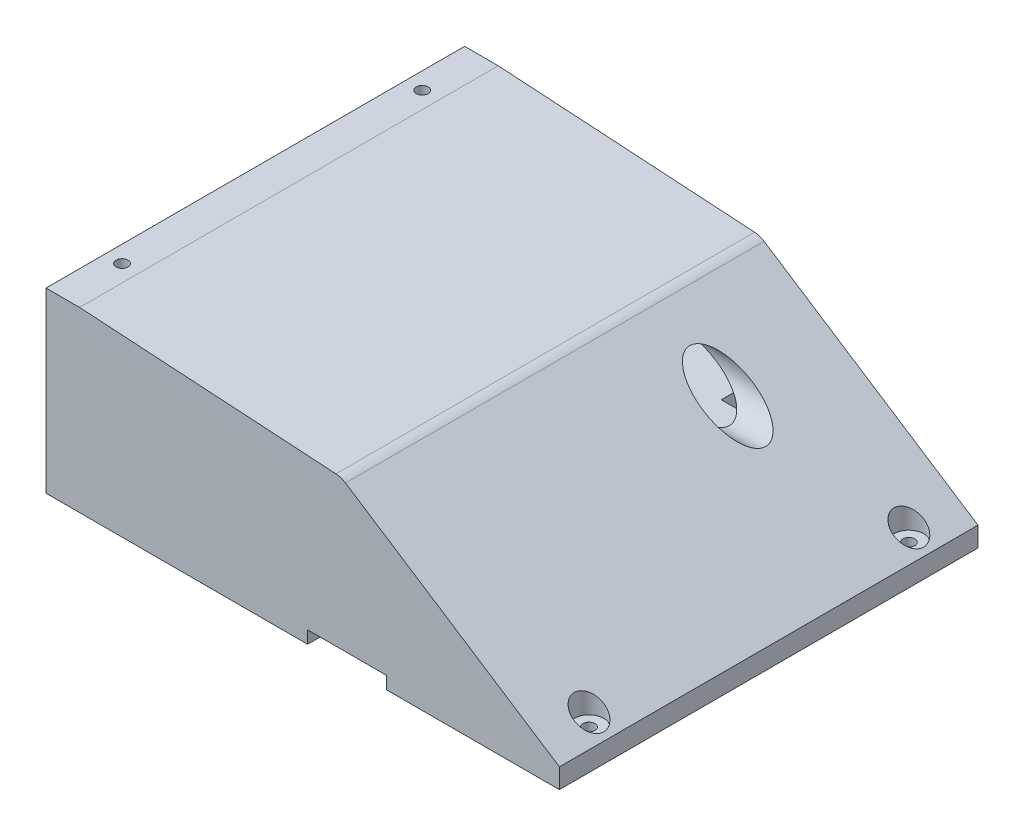
from build123d import *

# Parameters (mm, degrees)
BOSS_EXTRUDE1_DEPTH     = 212
BOSS_EXTRUDE2_DEPTH     = 10
BOSS_EXTRUDE3_DEPTH     = 10
SKETCH4_R               = 3
CUT_EXTRUDE1_DEPTH      = 348.338451658
SKETCH6_R               = 7.5
CUT_EXTRUDE2_DEPTH      = 345.882588717
SKETCH7_R               = 1.5
SKETCH7_R_2             = 12.5
SKETCH7_W               = 10
SKETCH7_H               = 120
SKETCH7_W_2             = 60
SKETCH7_H_2             = 15
CUT_EXTRUDE3_DEPTH      = 12.5
CUT_EXTRUDE4_REACH      = 276.574
SKETCH8_R               = 12.5
CUT_EXTRUDE5_DEPTH      = 342.714793358
CUT_EXTRUDE5_DEPTH_BACK = 342.714793358
SKETCH9_R               = 3
CUT_EXTRUDE6_DEPTH      = 348.338451658
CUT_EXTRUDE6_DEPTH_BACK = 348.338451658
SKETCH10_W              = 40
SKETCH10_H              = 6.35
FILLET1_R               = 10


with BuildPart() as part:
    # Sketch1 → Boss-Extrude1 (new body)
    with BuildSketch(Plane.XY):
        Polygon((0, 0), (-20, 0), (-20, 20), (-242.984559153, 20), (-242.984559153, 25), (-260, 25), (-260, 30), (-49.158083864, 30), (-122.301669645, 77.5), (-242.984559153, 85), (-260, 85), (-260, 90), (-242.984559153, 90), (-110.511971445, 81.767313396), (0, 10), align=None)
    extrude(amount=BOSS_EXTRUDE1_DEPTH)

    # Sketch2 → Boss-Extrude2 (add)
    with BuildSketch(Plane(origin=(0, 0, 0), x_dir=(-1, 0, 0), z_dir=(0, 0, -1))):
        Polygon((0, 0), (260, 0), (260, 90), (110.511971445, 81.767313396), (0, 10), align=None)
    extrude(amount=-BOSS_EXTRUDE2_DEPTH)

    # Sketch3 → Boss-Extrude3 (add)
    with BuildSketch(Plane.XY.offset(212)):
        Polygon((-110.511971445, 81.767313396), (0, 10), (0, 0), (-260, 0), (-260, 90), align=None)
    extrude(amount=-BOSS_EXTRUDE3_DEPTH)

    # Sketch4 → Cut-Extrude1 (cut, through all)
    with BuildSketch(Plane.XZ):
        with Locations((-10, 187)):
            Circle(SKETCH4_R)
        with Locations((-10, 25)):
            Circle(SKETCH4_R)
    extrude(amount=-CUT_EXTRUDE1_DEPTH, mode=Mode.SUBTRACT)

    # Sketch6 → Cut-Extrude2 (cut, through all)
    with BuildSketch(Plane(origin=(0, 10, 0), x_dir=(-1, 0, 0), z_dir=(0, -1, 0))):
        with Locations((10, -25)):
            Circle(SKETCH6_R)
        with Locations((10, -187)):
            Circle(SKETCH6_R)
    extrude(amount=-CUT_EXTRUDE2_DEPTH, mode=Mode.SUBTRACT)

    # Sketch7 → Cut-Extrude3 (cut)
    with BuildSketch(Plane.XZ.offset(-20)):
        with Locations((-161.484559153, 161)):
            Circle(SKETCH7_R)
        with Locations((-225.684559153, 161)):
            Circle(SKETCH7_R)
        with Locations((-161.484559153, 51)):
            Circle(SKETCH7_R)
        with Locations((-225.684559153, 51)):
            Circle(SKETCH7_R)
        with Locations((-67.984559153, 136)):
            Circle(SKETCH7_R_2)
        with Locations((-92.099111311, 106)):
            Rectangle(SKETCH7_W, SKETCH7_H)
        with Locations((-70, 22.5)):
            Rectangle(SKETCH7_W_2, SKETCH7_H_2)
    extrude(amount=-CUT_EXTRUDE3_DEPTH, mode=Mode.SUBTRACT)

    # Sketch8 → Cut-Extrude4 (cut, up to next)
    with BuildSketch(Plane.ZY.offset(110.511971445), mode=Mode.PRIVATE) as cut_extrude4_sk1:
        with Locations((54, 57.25)):
            Circle(SKETCH8_R)
    cut_extrude4_tool1 = extrude(cut_extrude4_sk1.sketch, amount=-CUT_EXTRUDE4_REACH, mode=Mode.PRIVATE) & part.part
    add(cut_extrude4_tool1.solids().sort_by_distance((-110.511971, 57.25, 54))[0], mode=Mode.SUBTRACT)

    # Sketch9 → Cut-Extrude5 (cut, two sides: drawn at the far end of the back side and taken through both)
    with BuildSketch(Plane.XZ.offset(-25).offset(-CUT_EXTRUDE5_DEPTH_BACK)):
        with Locations((-251.5, 182)):
            Circle(SKETCH9_R)
        with Locations((-251.5, 30)):
            Circle(SKETCH9_R)
    extrude(amount=CUT_EXTRUDE5_DEPTH + CUT_EXTRUDE5_DEPTH_BACK, mode=Mode.SUBTRACT)

    # Sketch10 → Cut-Extrude6 (cut, two sides: drawn at the far end of the back side and taken through both)
    with BuildSketch(Plane.XY.offset(212).offset(-CUT_EXTRUDE6_DEPTH_BACK)):
        with Locations((-107.5, 3.175)):
            Rectangle(SKETCH10_W, SKETCH10_H)
    extrude(amount=CUT_EXTRUDE6_DEPTH + CUT_EXTRUDE6_DEPTH_BACK, mode=Mode.SUBTRACT)

    # Fillet1
    fillet1_edges = [part.edges().sort_by_distance(p)[0] for p in [
        (-110.511971445, 81.767313396, 106),
    ]]
    fillet(fillet1_edges, radius=FILLET1_R)


solid = part.part
